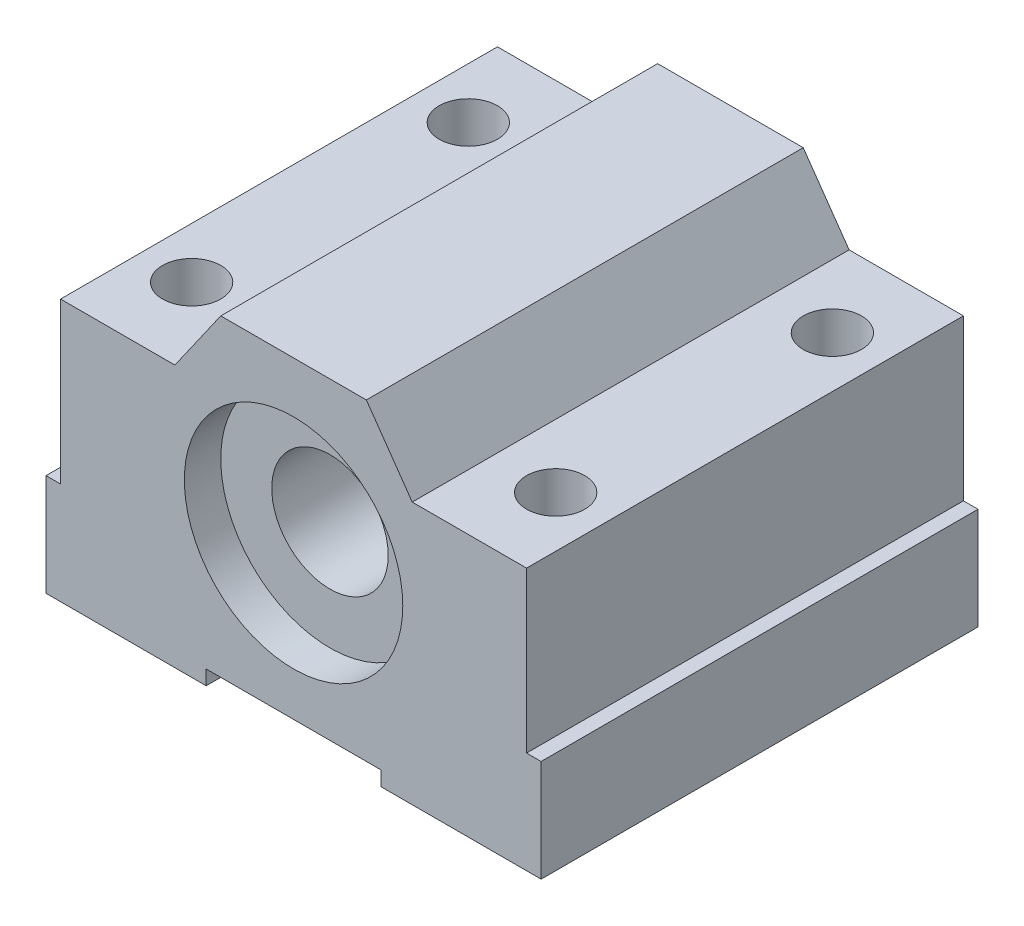
from build123d import *

# Parameters (mm, degrees)
SKETCH1_W           = 10
SKETCH1_H           = 30
SKETCH1_W_2         = 1
BOSS_EXTRUDE1_DEPTH = 1
BOSS_EXTRUDE4_START = 1
SKETCH1_3_W         = 34
SKETCH1_3_H         = 30
BOSS_EXTRUDE4_DEPTH = 6
BOSS_EXTRUDE5_START = 7
SKETCH1_4_W         = 10
SKETCH1_4_H         = 30
SKETCH1_4_W_2       = 12
BOSS_EXTRUDE5_DEPTH = 11
SKETCH3_W           = 8.5
SKETCH3_H           = 30
BOSS_EXTRUDE6_DEPTH = 4.5
CHAMFER1_SIZE       = 5
CHAMFER1_SIZE_2     = 3.501037691
SKETCH5_R           = 7.5
SKETCH5_R_2         = 4
CUT_EXTRUDE1_DEPTH  = 2.5
SKETCH5_3_R         = 4
CUT_EXTRUDE2_DEPTH  = 51.618672444
CUT_EXTRUDE4_START  = -27.5
SKETCH5_4_R         = 7.5
SKETCH5_4_R_2       = 4
CUT_EXTRUDE4_DEPTH  = 2.5
SKETCH6_R           = 2
CUT_EXTRUDE5_DEPTH  = 49.785243671


with BuildPart() as part:
    # Sketch1 → Boss-Extrude1 (new body)
    with BuildSketch(Plane(origin=(0, 0, 0), x_dir=(1, 0, 0), z_dir=(0, 1, 0))):
        with Locations((28, 15)):
            Rectangle(SKETCH1_W, SKETCH1_H)
        with Locations((33.5, 15)):
            Rectangle(SKETCH1_W_2, SKETCH1_H)
        with Locations((0.5, 15)):
            Rectangle(SKETCH1_W_2, SKETCH1_H)
        with Locations((6, 15)):
            Rectangle(SKETCH1_W, SKETCH1_H)
    extrude(amount=BOSS_EXTRUDE1_DEPTH)

    # Sketch1<3> → Boss-Extrude4 (add)
    with BuildSketch(Plane(origin=(0, 0, 0), x_dir=(1, 0, 0), z_dir=(0, 1, 0)).offset(BOSS_EXTRUDE4_START)):
        with Locations((17, 15)):
            Rectangle(SKETCH1_3_W, SKETCH1_3_H)
    extrude(amount=BOSS_EXTRUDE4_DEPTH)

    # Sketch1<4> → Boss-Extrude5 (add)
    with BuildSketch(Plane(origin=(0, 0, 0), x_dir=(1, 0, 0), z_dir=(0, 1, 0)).offset(BOSS_EXTRUDE5_START)):
        with Locations((6, 15)):
            Rectangle(SKETCH1_4_W, SKETCH1_4_H)
        with Locations((28, 15)):
            Rectangle(SKETCH1_4_W, SKETCH1_4_H)
        with Locations((17, 15)):
            Rectangle(SKETCH1_4_W_2, SKETCH1_4_H)
    extrude(amount=BOSS_EXTRUDE5_DEPTH)

    # Sketch3 → Boss-Extrude6 (add)
    with BuildSketch(Plane(origin=(0, 18, 0), x_dir=(1, 0, 0), z_dir=(0, 1, 0))):
        with Locations((21.25, 15)):
            Rectangle(SKETCH3_W, SKETCH3_H)
        with Locations((12.75, 15)):
            Rectangle(SKETCH3_W, SKETCH3_H)
    extrude(amount=BOSS_EXTRUDE6_DEPTH)

    # Chamfer1
    # the kernel refuses this chamfer: 5, 3.501037691 mm, written as the material it takes off along each edge
    with BuildSketch(Plane(origin=(25.5, 22.5, 12.912761151), x_dir=(0, -1, 0), z_dir=(0, 0, -1))) as chamfer1_piece_1_section:
        Polygon((CHAMFER1_SIZE, 0), (0, CHAMFER1_SIZE_2), (0, 0), align=None)
    chamfer1_piece_1 = extrude(amount=55.825522303, mode=Mode.PRIVATE)
    chamfer1_piece_1 = split(chamfer1_piece_1, bisect_by=Plane(origin=(25.5, 18, 12.912761151), z_dir=(0, 1, 0)), keep=Keep.TOP, mode=Mode.PRIVATE)
    add(chamfer1_piece_1, mode=Mode.SUBTRACT)
    with BuildSketch(Plane(origin=(8.5, 22.5, -42.912761151), x_dir=(0, -1, 0), z_dir=(0, 0, 1))) as chamfer1_piece_2_section:
        Polygon((CHAMFER1_SIZE, 0), (0, CHAMFER1_SIZE_2), (0, 0), align=None)
    chamfer1_piece_2 = extrude(amount=55.825522303, mode=Mode.PRIVATE)
    chamfer1_piece_2 = split(chamfer1_piece_2, bisect_by=Plane(origin=(8.5, 18, -42.912761151), z_dir=(0, 1, 0)), keep=Keep.TOP, mode=Mode.PRIVATE)
    add(chamfer1_piece_2, mode=Mode.SUBTRACT)

    # Sketch5 → Cut-Extrude1 (cut)
    # profile 1 of 2: a face of its own
    with BuildSketch(Plane.XY):
        with Locations((17, 11.5)):
            Circle(SKETCH5_R)
        with Locations((17, 11.5)):
            Circle(SKETCH5_R_2, mode=Mode.SUBTRACT)
    # profile 2 of 2: a face of its own
    with BuildSketch(Plane.XY):
        with Locations((17, 11.5)):
            Circle(SKETCH5_R_2)
    extrude(amount=-CUT_EXTRUDE1_DEPTH, mode=Mode.SUBTRACT)

    # Sketch5<3> → Cut-Extrude2 (cut, through all)
    with BuildSketch(Plane.XY):
        with Locations((17, 11.5)):
            Circle(SKETCH5_3_R)
    extrude(amount=-CUT_EXTRUDE2_DEPTH, mode=Mode.SUBTRACT)

    # Sketch5<4> → Cut-Extrude4 (cut)
    # profile 1 of 2: a face of its own
    with BuildSketch(Plane.XY.offset(CUT_EXTRUDE4_START)):
        with Locations((17, 11.5)):
            Circle(SKETCH5_4_R)
        with Locations((17, 11.5)):
            Circle(SKETCH5_4_R_2, mode=Mode.SUBTRACT)
    # profile 2 of 2: a face of its own
    with BuildSketch(Plane.XY.offset(CUT_EXTRUDE4_START)):
        with Locations((17, 11.5)):
            Circle(SKETCH5_4_R_2)
    extrude(amount=-CUT_EXTRUDE4_DEPTH, mode=Mode.SUBTRACT)

    # Sketch6 → Cut-Extrude5 (cut, through all)
    with BuildSketch(Plane(origin=(0, 18, 0), x_dir=(1, 0, 0), z_dir=(0, 1, 0))):
        with Locations(Location((29.5, 24.5, 0), (0, 0, 270))):
            Circle(SKETCH6_R)
        with Locations(Location((29.5, 5.5, 0), (0, 0, 270))):
            Circle(SKETCH6_R)
        with Locations(Location((4.5, 24.5, 0), (0, 0, 90))):
            Circle(SKETCH6_R)
        with Locations(Location((4.5, 5.5, 0), (0, 0, 90))):
            Circle(SKETCH6_R)
    extrude(amount=-CUT_EXTRUDE5_DEPTH, mode=Mode.SUBTRACT)


solid = part.part
